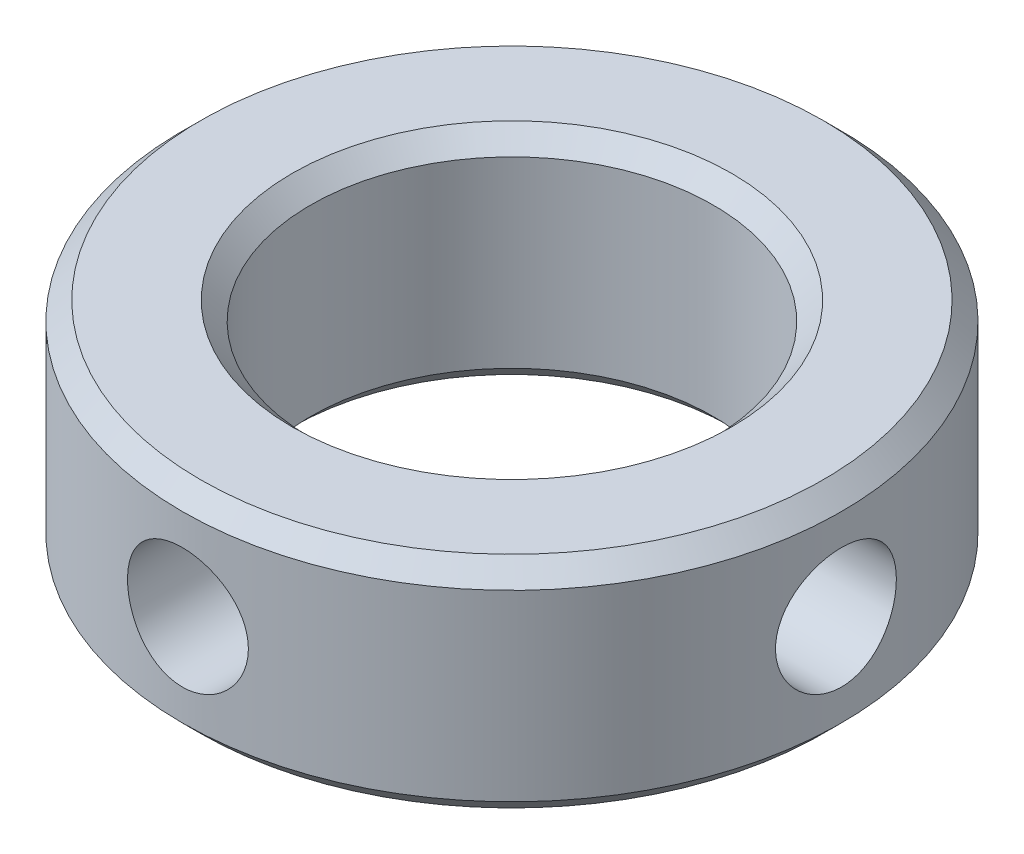
from build123d import *

# Parameters (mm, degrees)
CROQUIS1_R              = 9
CROQUIS1_R_2            = 5.5
SALIENTE_EXTRUIR1_DEPTH = 6
MATRIZC1_COUNT          = 2
MATRIZC1_ANGLE          = 90
CHAFL_N1_SIZE           = 0.5
CHAFL_N2_SIZE           = 0.5


with BuildPart() as part:
    # Croquis1 → Saliente-Extruir1 (new body)
    with BuildSketch(Plane(origin=(0, 0, 0), x_dir=(1, 0, 0), z_dir=(0, 1, 0))):
        Circle(CROQUIS1_R)
        Circle(CROQUIS1_R_2, mode=Mode.SUBTRACT)
    extrude(amount=SALIENTE_EXTRUIR1_DEPTH)

    # Croquis3 → Taladro roscado M41 (revolve, cut)
    with BuildSketch(Plane(origin=(0, 3, 9), x_dir=(0, -1, 0), z_dir=(1, 0, 0))):
        Polygon((0, 0), (0, 12.491420021), (1.65, 11.5), (1.65, 0), align=None)
    taladro_roscado_m41 = revolve(axis=Axis((0, 3, 15.35), (0, 0, -1)), mode=Mode.SUBTRACT)

    # MatrizC1: Taladro roscado M41 ×2 about axis
    matrizc1_axis = Axis((0, 0, 0), (0, 1, 0))
    for i in range(1, MATRIZC1_COUNT):
        add(taladro_roscado_m41.rotate(matrizc1_axis, i * MATRIZC1_ANGLE / (MATRIZC1_COUNT - 1)), mode=Mode.SUBTRACT)

    # Chaflán1
    chafl_n1_edges = [part.edges().sort_by_distance(p)[0] for p in [
        (-5.5, 6, 0),
        (-5.5, 0, 0),
    ]]
    chamfer(chafl_n1_edges, length=CHAFL_N1_SIZE)

    # Chaflán2
    chafl_n2_edges = [part.edges().sort_by_distance(p)[0] for p in [
        (-9, 6, 0),
        (-9, 0, 0),
    ]]
    chamfer(chafl_n2_edges, length=CHAFL_N2_SIZE)


solid = part.part
